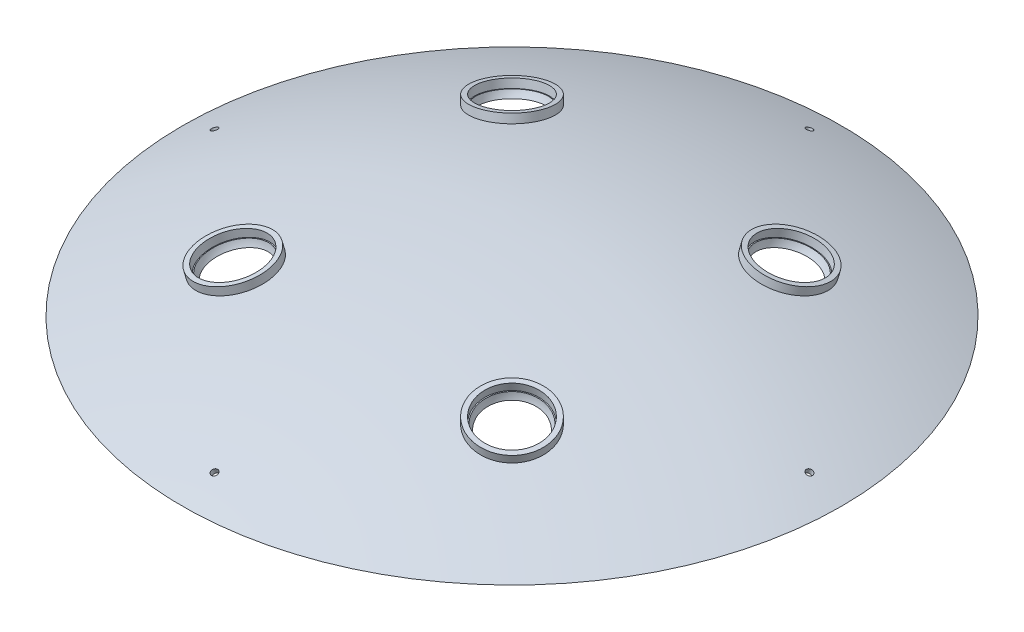
from build123d import *

# Parameters (mm, degrees)
CIRPATTERN2_COUNT = 4
CIRPATTERN3_COUNT = 4


with BuildPart() as part:
    # Sketch1 → Revolve1 (revolve)
    with BuildSketch(Plane.XY):
        with BuildLine():
            ThreePointArc((-96.450372245, 351.283998775), (-98.304910564, 350.499686156), (-100.153071713, 349.700462136))
            Line((-100.153071713, 349.700462136), (-97.729610096, 348.570383425))
            ThreePointArc((-97.729610096, 348.570383425), (-49.884385754, 363.569703341), (0, 368.638544248))
            Line((0, 368.638544248), (0, 370.638544248))
            ThreePointArc((0, 370.638544248), (-49.186565078, 365.752154266), (-96.450372245, 351.283998775))
        make_face()
    revolve(axis=Axis((0, 394.944466532, 0), (0, 1, 0)))

    # Sketch3 → Cut-Revolve1 (revolve, cut)
    with BuildSketch(Plane.XY):
        with BuildLine():
            ThreePointArc((-89.446639152, 354.089392918), (-89.913362889, 353.910032378), (-90.37972697, 353.729738747))
            Line((-90.37972697, 353.729738747), (-89.295170247, 350.932644413))
            ThreePointArc((-89.295170247, 350.932644413), (-88.362065993, 351.292278867), (-87.427513364, 351.648132593))
            Line((-87.427513364, 351.648132593), (-87.971991647, 353.052353403))
            ThreePointArc((-87.971991647, 353.052353403), (-88.438718646, 352.873001309), (-88.905083831, 352.692710488))
            Line((-88.905083831, 352.692710488), (-89.446639152, 354.089392918))
        make_face()
    cut_revolve1 = revolve(axis=Axis((0, 120.638544248, 0), (-0.3615189078815354, 0.9323647779941829, 0)), mode=Mode.SUBTRACT)

    # CirPattern2: Cut-Revolve1 ×4 about axis
    cirpattern2_axis = Axis((0, 0, 0), (0, 1, 0))
    for i in range(1, CIRPATTERN2_COUNT):
        add(cut_revolve1.rotate(cirpattern2_axis, i * 360 / CIRPATTERN2_COUNT), mode=Mode.SUBTRACT)

    # Sketch5 → Cut-Revolve5 (revolve, cut)
    with BuildSketch(Plane(origin=(0, 0, 0), x_dir=(0, 1, 0), z_dir=(0.7071067811865488, 0, 0.7071067811865464))):
        with BuildLine():
            ThreePointArc((356.088544248, 60), (365.638544248, 50.45), (375.188544248, 60))
            Line((375.188544248, 60), (356.088544248, 60))
        make_face()
    cut_revolve5 = revolve(axis=Axis((-42.426406871, 356.088544248, 42.426406871), (0, -1, 0)), mode=Mode.SUBTRACT)

    # Sketch5<9> → Revolve3 (revolve)
    with BuildSketch(Plane(origin=(0, 0, 0), x_dir=(0, 1, 0), z_dir=(0.7071067811865488, 0, 0.7071067811865464))):
        Polygon((360.346185197, 68.536122954), (363.366897883, 69.275889326), (363.010094789, 70.732835294), (360.597111075, 70.141900506), (359.989382103, 69.993068922), align=None)
    revolve3 = revolve(axis=Axis((0, 120.638544248, 0), (-0.1681985915763013, 0.9712973116319725, 0.16819859157630185)))

    # CirPattern3: Cut-Revolve5, Revolve3 ×4 about axis
    cirpattern3_axis = Axis((0, 0, 0), (0, 1, 0))
    add([cut_revolve5.rotate(cirpattern3_axis, i * 360 / CIRPATTERN3_COUNT) for i in range(1, CIRPATTERN3_COUNT)], mode=Mode.SUBTRACT)
    add([revolve3.rotate(cirpattern3_axis, i * 360 / CIRPATTERN3_COUNT) for i in range(1, CIRPATTERN3_COUNT)])


solid = part.part
